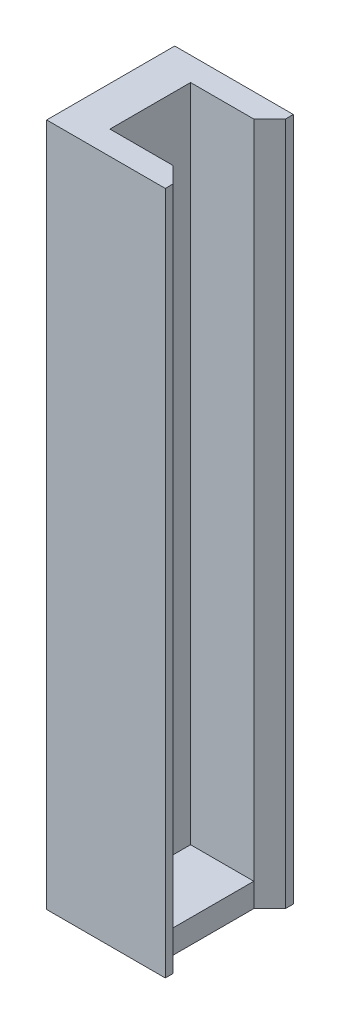
from build123d import *

# Parameters (mm, degrees)
SKETCH_1_W            = 10
SKETCH_1_H            = 83.5
SKETCH_1_R            = 1.6
EXTRUDE_1_DEPTH       = 5
MOVE_START            = -5.1
MOVE_FACE_1_OUTLINE_W = 5
MOVE_FACE_1_OUTLINE_H = 83.5
MOVE_FACE_1_DEPTH     = 0.1
SKETCH_2_W            = 15
SKETCH_2_H            = 5
EXTRUDE_2_DEPTH       = 3
MOVE_START_2          = 5
MOVE_FACE_2_OUTLINE_W = 5
MOVE_FACE_2_OUTLINE_H = 83.5
MOVE_FACE_2_DEPTH     = 0.1
CHAMFER_1_SIZE        = 2
SKETCH_3_W            = 8
SKETCH_3_H            = 10.2
EXTRUDE_3_DEPTH       = 3
EXTRUDE_4_DEPTH       = 73.5


# Read off the part's stored shape, not the designer's step: 面の移動1, 面の移動2
with BuildPart() as part:
    # ｽｹｯﾁ1 → ﾎﾞｽ - 押し出し1 (new body)
    with BuildSketch(Plane.ZY.offset(7.5)):
        with Locations((0, -68.25)):
            Rectangle(SKETCH_1_W, SKETCH_1_H)
        with Locations((0, -74)):
            Circle(SKETCH_1_R, mode=Mode.SUBTRACT)
        with Locations((0, -34)):
            Circle(SKETCH_1_R, mode=Mode.SUBTRACT)
    extrude(amount=EXTRUDE_1_DEPTH)

    # Move Face 1 outline → Move Face 1 (add)
    with BuildSketch(Plane.XY.offset(MOVE_START)):
        with Locations((-10, -68.25)):
            Rectangle(MOVE_FACE_1_OUTLINE_W, MOVE_FACE_1_OUTLINE_H)
    extrude(amount=MOVE_FACE_1_DEPTH)

    # ｽｹｯﾁ2 → ﾎﾞｽ - 押し出し2 (add)
    with BuildSketch(Plane(origin=(0, 0, -5.1), x_dir=(-1, 0, 0), z_dir=(0, 0, -1))):
        with Locations((5, -107.5)):
            Rectangle(SKETCH_2_W, SKETCH_2_H)
        with Locations((5, -29)):
            Rectangle(SKETCH_2_W, SKETCH_2_H)
        with Locations((5, -68.25)):
            Rectangle(SKETCH_2_W, SKETCH_2_H)
    extrude_2 = extrude(amount=EXTRUDE_2_DEPTH)

    # Move Face 2 outline → Move Face 2 (add)
    with BuildSketch(Plane.XY.offset(MOVE_START_2)):
        with Locations((-10, -68.25)):
            Rectangle(MOVE_FACE_2_OUTLINE_W, MOVE_FACE_2_OUTLINE_H)
    extrude(amount=MOVE_FACE_2_DEPTH)

    # ﾐﾗｰ2: ﾎﾞｽ - 押し出し2 across plane
    add(extrude_2.mirror(Plane.XY))

    # 面取り1
    chamfer_1_edges = [part.edges().sort_by_distance(p)[0] for p in [
        (2.5, -107.5, -5.1),
        (2.5, -29, -5.1),
        (2.5, -68.25, -5.1),
        (2.5, -107.5, 5.1),
        (2.5, -29, 5.1),
        (2.5, -68.25, 5.1),
    ]]
    chamfer(chamfer_1_edges, length=CHAMFER_1_SIZE)

    # ｽｹｯﾁ3 → ﾎﾞｽ - 押し出し3 (add)
    with BuildSketch(Plane.XZ.offset(110)):
        Polygon((-7.5, -5.1), (-7.5, 5.1), (0.5, 5.1), (2.5, 7.1), (2.5, 8.1), (-12.5, 8.1), (-12.5, -8.1), (2.5, -8.1), (2.5, -7.1), (0.5, -5.1), align=None)
        with Locations((-3.5, 0)):
            Rectangle(SKETCH_3_W, SKETCH_3_H)
    extrude(amount=EXTRUDE_3_DEPTH)

    # ｽｹｯﾁ4 → ﾎﾞｽ - 押し出し4 (add)
    with BuildSketch(Plane.XZ.offset(31.5)):
        Polygon((-7.5, 5.1), (0.5, 5.1), (2.5, 7.1), (2.5, 8.1), (-12.5, 8.1), (-12.5, 5.1), align=None)
        Polygon((2.5, -8.1), (2.5, -7.1), (0.5, -5.1), (-7.5, -5.1), (-12.5, -5.1), (-12.5, -8.1), align=None)
    extrude(amount=EXTRUDE_4_DEPTH)


solid = part.part
